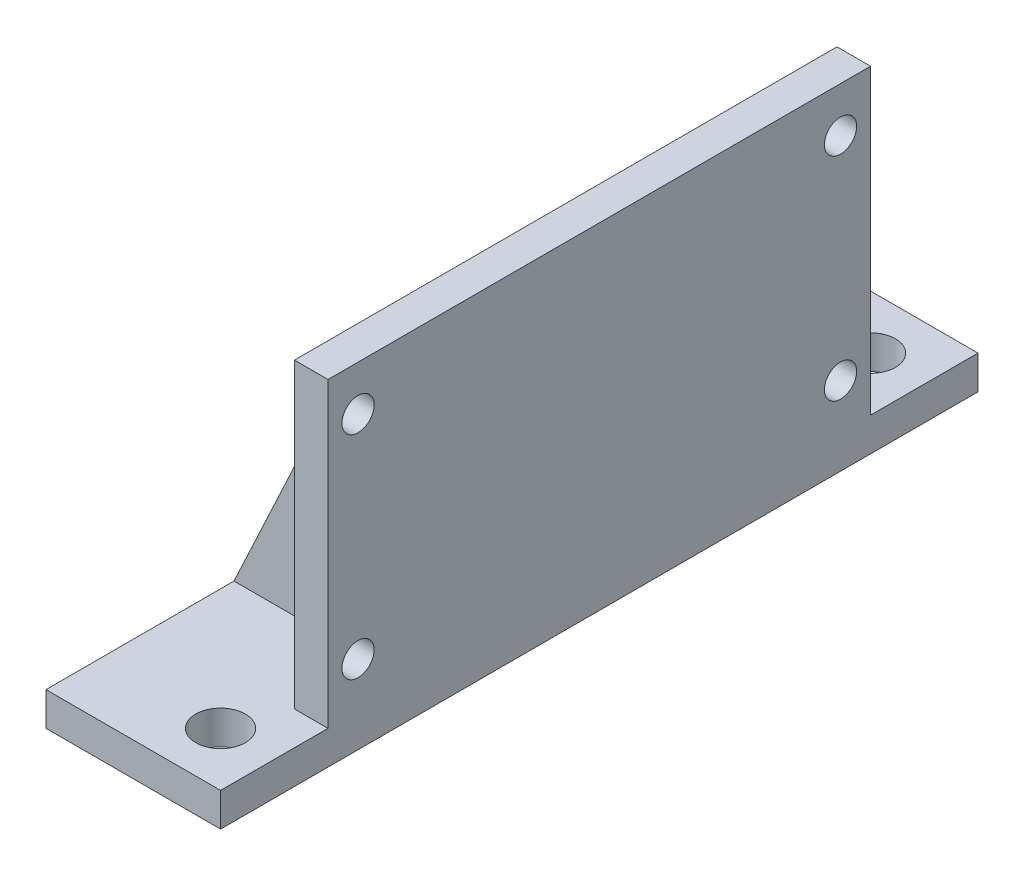
from build123d import *

# Parameters (mm, degrees)
SKETCH1_W           = 16.51
SKETCH1_H           = 71.632288028
SKETCH1_R           = 2.3495
BOSS_EXTRUDE1_DEPTH = 3.175
SKETCH2_W           = 51.312288028
SKETCH2_H           = 28.575
SKETCH2_R           = 1.524
BOSS_EXTRUDE2_DEPTH = 3.175
BOSS_EXTRUDE3_DEPTH = 2.54


with BuildPart() as part:
    # Sketch1 → Boss-Extrude1 (new body)
    with BuildSketch(Plane(origin=(0, 0, 0), x_dir=(1, 0, 0), z_dir=(0, 1, 0))):
        with Locations((-3.175, 30.736144014)):
            Rectangle(SKETCH1_W, SKETCH1_H)
        Circle(SKETCH1_R, mode=Mode.SUBTRACT)
        with Locations((0, 61.472288028)):
            Circle(SKETCH1_R, mode=Mode.SUBTRACT)
    extrude(amount=BOSS_EXTRUDE1_DEPTH)

    # Sketch2 → Boss-Extrude2 (add)
    with BuildSketch(Plane(origin=(5.08, 0, 0), x_dir=(0, 0, -1), z_dir=(1, 0, 0))):
        with Locations((30.736144014, 17.4625)):
            Rectangle(SKETCH2_W, SKETCH2_H)
        with Locations((7.921390431, 7.4295)):
            Circle(SKETCH2_R, mode=Mode.SUBTRACT)
        with Locations((53.550897597, 7.4295)):
            Circle(SKETCH2_R, mode=Mode.SUBTRACT)
        with Locations((7.921390431, 27.4955)):
            Circle(SKETCH2_R, mode=Mode.SUBTRACT)
        with Locations((53.550897597, 27.4955)):
            Circle(SKETCH2_R, mode=Mode.SUBTRACT)
    extrude(amount=-BOSS_EXTRUDE2_DEPTH)

    # Sketch3 → Boss-Extrude3 (add)
    with BuildSketch(Plane(origin=(0, 0, -48.772288028), x_dir=(-1, 0, 0), z_dir=(0, 0, -1))):
        Polygon((-1.905, 31.75), (-1.905, 3.175), (11.43, 3.175), align=None)
    boss_extrude3 = extrude(amount=-BOSS_EXTRUDE3_DEPTH)

    # Mirror1: Boss-Extrude3 across plane
    add(boss_extrude3.mirror(Plane.XY.offset(-30.736144014)))


solid = part.part
